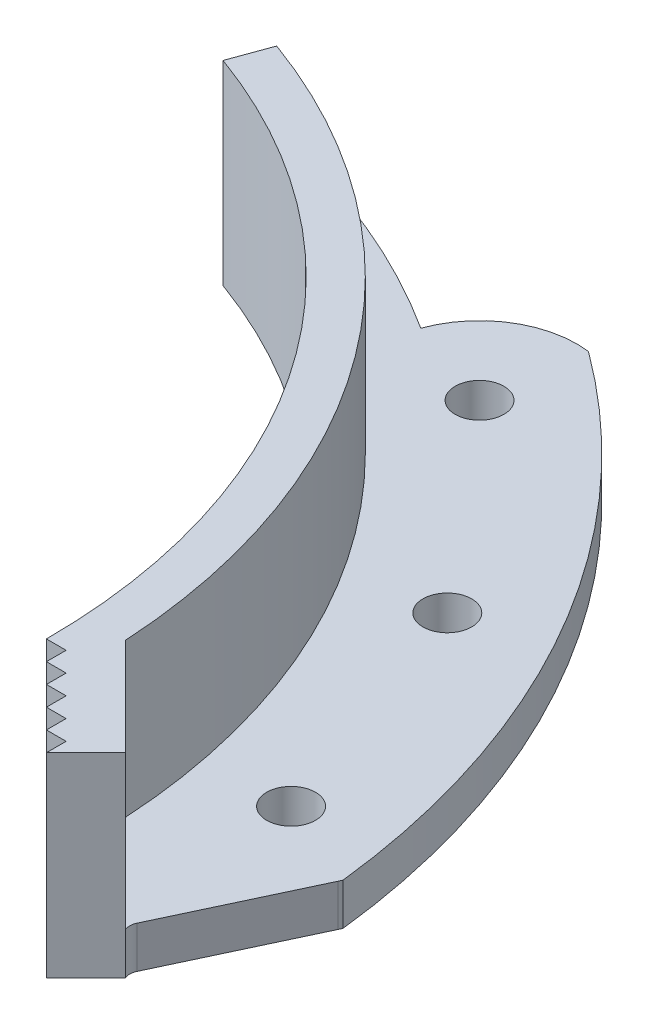
from build123d import *

# Parameters (mm, degrees)
SKETCH_1_R               = 1.75
EXTRUDE_1_DEPTH          = 3
EXTRUDE_2_DEPTH          = 11
EXTRUDE_2_DEPTH_BACK     = 3
CUT_EXTRUDE_1_DEPTH      = 79.296095621
CUT_EXTRUDE_1_DEPTH_BACK = 79.296095621
SKETCH_4_R               = 75.737398045
SKETCH_4_R_2             = 60
FILLET_1_R               = 1


with BuildPart() as part:
    # Эскиз1 → Бобышка-Вытянуть1 (new body)
    with BuildSketch(Plane(origin=(0, 0, 0), x_dir=(1, 0, 0), z_dir=(0, 1, 0))):
        with BuildLine():
            Line((15.39090645, 42.286167935), (17.785047453, 48.864016281))
            ThreePointArc((17.785047453, 48.864016281), (23.097425832, 46.588720952), (28.124517408, 43.737987157))
            ThreePointArc((28.124517408, 43.737987157), (32.887215772, 48.124766732), (39.210044191, 46.72871103))
            ThreePointArc((39.210044191, 46.72871103), (52.827549631, 30.5), (60.073272934, 10.592538838))
            ThreePointArc((60.073272934, 10.592538838), (60.118729466, 8.455730047), (59.51728837, 6.404806668))
            Line((59.51728837, 6.404806668), (54.192372599, -4.949615977))
            Line((54.192372599, -4.949615977), (44.777960949, 4.464774712))
            ThreePointArc((44.777960949, 4.464774712), (35.534315772, 27.610005481), (15.39090645, 42.286167935))
        make_face()
        with Locations(Location((34.710530923, 41.366399928, 0), (0, 0, 270))):
            Circle(SKETCH_1_R, mode=Mode.SUBTRACT)
        with Locations(Location((46.765371804, 27, 0), (0, 0, 270))):
            Circle(SKETCH_1_R, mode=Mode.SUBTRACT)
        with Locations(Location((53.179618663, 9.377001594, 0), (0, 0, 270))):
            Circle(SKETCH_1_R, mode=Mode.SUBTRACT)
    extrude(amount=EXTRUDE_1_DEPTH)

    # Эскиз2 → Бобышка-Вытянуть2 (add, two sides: drawn at the far end of the back side and taken through both)
    with BuildSketch(Plane(origin=(0, 3, 0), x_dir=(1, 0, 0), z_dir=(0, 1, 0)).offset(-EXTRUDE_2_DEPTH_BACK)):
        with BuildLine():
            Line((52.071067812, -7.071067812), (52.071067812, -5.656854249))
            Line((52.071067812, -5.656854249), (50.656854249, -5.656854249))
            Line((50.656854249, -5.656854249), (50.656854249, -4.242640687))
            Line((50.656854249, -4.242640687), (49.242640687, -4.242640687))
            Line((49.242640687, -4.242640687), (49.242640687, -2.828427125))
            Line((49.242640687, -2.828427125), (47.828427125, -2.828427125))
            Line((47.828427125, -2.828427125), (47.828427125, -1.414213562))
            Line((47.828427125, -1.414213562), (46.414213562, -1.414213562))
            Line((46.414213562, -1.414213562), (46.414213562, 0))
            Line((46.414213562, 0), (45, 0))
            ThreePointArc((45, 0), (36.861841993, 25.810939636), (15.39090645, 42.286167935))
            Line((15.39090645, 42.286167935), (16.41696688, 45.105245798))
            ThreePointArc((16.41696688, 45.105245798), (38.518692264, 28.641060494), (47.922027533, 2.734826717))
            Line((47.922027533, 2.734826717), (54.899494937, -4.242640687))
            Line((54.899494937, -4.242640687), (52.071067812, -7.071067812))
        make_face()
    extrude(amount=EXTRUDE_2_DEPTH + EXTRUDE_2_DEPTH_BACK)

    # Эскиз4 → Вырез-Вытянуть1 (cut, two sides: drawn at the far end of the back side and taken through both)
    with BuildSketch(Plane(origin=(0, 3, 0), x_dir=(1, 0, 0), z_dir=(0, 1, 0)).offset(-CUT_EXTRUDE_1_DEPTH_BACK)):
        Circle(SKETCH_4_R)
        Circle(SKETCH_4_R_2, mode=Mode.SUBTRACT)
    extrude(amount=CUT_EXTRUDE_1_DEPTH + CUT_EXTRUDE_1_DEPTH_BACK, mode=Mode.SUBTRACT)

    # Скругление1
    # the kernel refuses this fillet: 1 mm, written as the material it adds along each edge
    with BuildSketch(Plane(origin=(54.643826402, 0, 3.986972152), x_dir=(0.7071067811866617, 0, 0.7071067811864333), z_dir=(0, 1, 0))) as fillet_1_piece_1:
        with BuildLine():
            CenterArc((0.726813354, 0.93091204), FILLET_1_R, 199.874698522, 48.702735989)
            Line((-0.213624991, 0.590947748), (-0.232433757, 0.584148463))
            Line((-0.232433757, 0.584148463), (-0.018808767, -0.006799286))
            Line((-0.018808767, -0.006799286), (0, -0.02))
            ThreePointArc((0, -0.02), (0.180784955, -0.02), (0.35426504, -0.018618241))
            Line((0.35426504, -0.018618241), (0.361569909, 0))
        make_face()
    extrude(amount=3)


solid = part.part
